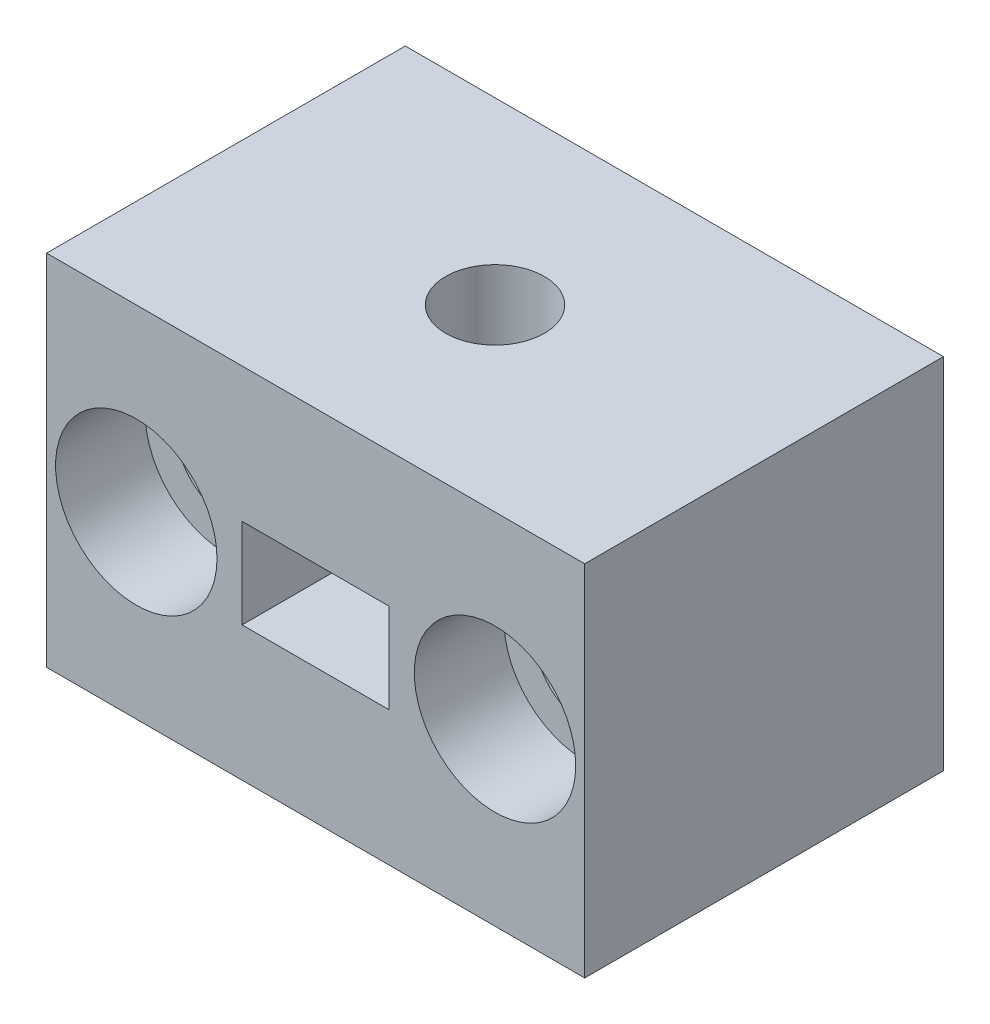
from build123d import *

# Parameters (mm, degrees)
SKETCH1_W           = 30
SKETCH1_H           = 20
BOSS_EXTRUDE1_DEPTH = 20
SKETCH2_R           = 2.75
SKETCH2_W           = 8.2
SKETCH2_H           = 5
CUT_EXTRUDE1_DEPTH  = 42.231056256
SKETCH3_R           = 2.75
CUT_EXTRUDE2_DEPTH  = 42.231056256
BOSS_EXTRUDE2_REACH = 40.161
SKETCH5_W           = 8
SKETCH5_H           = 6
BOSS_EXTRUDE3_DEPTH = 3
SKETCH6_R           = 4.5
CUT_EXTRUDE3_DEPTH  = 5


with BuildPart() as part:
    # Sketch1 → Boss-Extrude1 (new body)
    with BuildSketch(Plane.XY):
        with Locations((15, 10)):
            Rectangle(SKETCH1_W, SKETCH1_H)
    extrude(amount=BOSS_EXTRUDE1_DEPTH)

    # Sketch2 → Cut-Extrude1 (cut, through all)
    with BuildSketch(Plane.XY.offset(20)):
        with Locations((5, 10)):
            Circle(SKETCH2_R)
        with Locations((25, 10)):
            Circle(SKETCH2_R)
        with Locations((15, 10)):
            Rectangle(SKETCH2_W, SKETCH2_H)
    extrude(amount=-CUT_EXTRUDE1_DEPTH, mode=Mode.SUBTRACT)

    # Sketch3 → Cut-Extrude2 (cut, through all)
    with BuildSketch(Plane(origin=(0, 20, 0), x_dir=(1, 0, 0), z_dir=(0, 1, 0))):
        with Locations((15, -10)):
            Circle(SKETCH3_R)
    extrude(amount=-CUT_EXTRUDE2_DEPTH, mode=Mode.SUBTRACT)

    # Sketch4 → Boss-Extrude2 (add, up to next)
    with BuildSketch(Plane(origin=(0, 7.5, 0), x_dir=(1, 0, 0), z_dir=(0, 1, 0)), mode=Mode.PRIVATE) as boss_extrude2_sk1:
        Polygon((19.1, -7.5), (15.1, -5.133920143), (10.9, -7.5), (10.9, 0), (19.1, 0), align=None)
    boss_extrude2_tool1 = extrude(boss_extrude2_sk1.sketch, amount=BOSS_EXTRUDE2_REACH, mode=Mode.PRIVATE) - part.part
    add(boss_extrude2_tool1.solids().sort_by_distance((14.993757, 7.5, 3.195407))[0])

    # Sketch5 → Boss-Extrude3 (add)
    with BuildSketch(Plane(origin=(0, 0, 0), x_dir=(-1, 0, 0), z_dir=(0, 0, -1))):
        with Locations((-15, 10)):
            Rectangle(SKETCH5_W, SKETCH5_H)
    extrude(amount=BOSS_EXTRUDE3_DEPTH)

    # Sketch6 → Cut-Extrude3 (cut)
    with BuildSketch(Plane.XY.offset(20)):
        with Locations((5, 10)):
            Circle(SKETCH6_R)
        with Locations((25, 10)):
            Circle(SKETCH6_R)
    extrude(amount=-CUT_EXTRUDE3_DEPTH, mode=Mode.SUBTRACT)


solid = part.part
